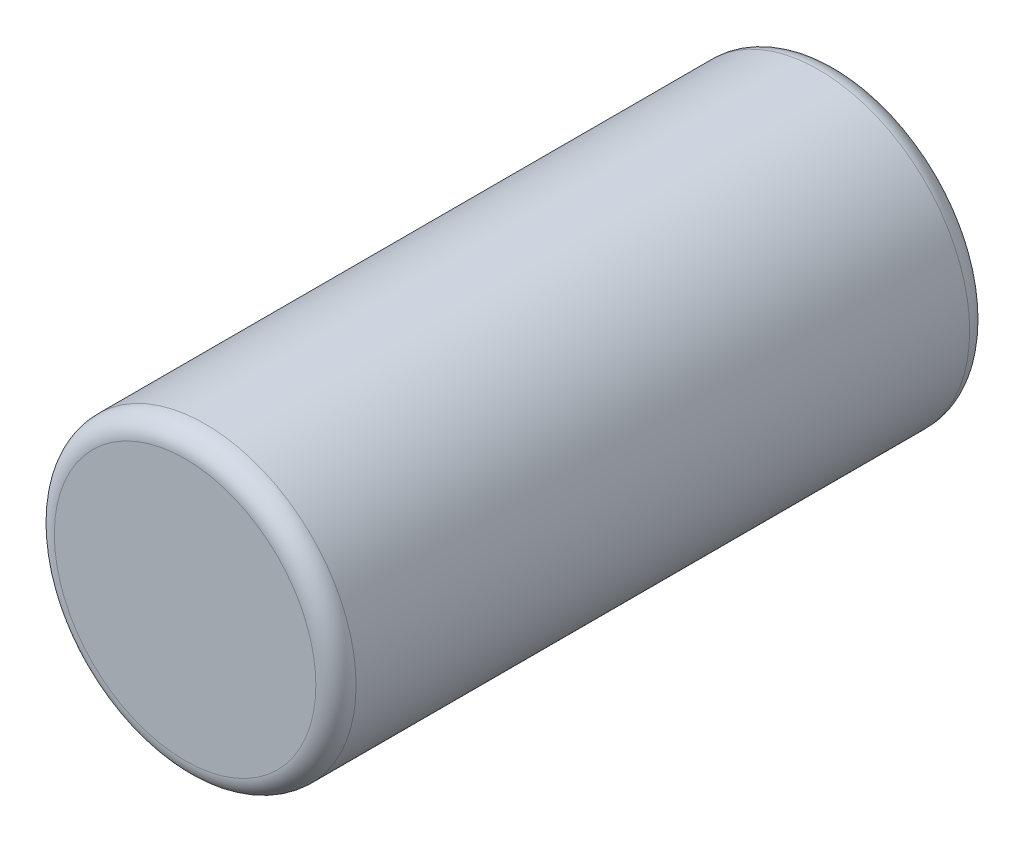
from build123d import *

# Parameters (mm, degrees)
SKETCH_1_R      = 1.5
EXTRUDE_2_DEPTH = 6.5
FILLET_2_R      = 0.2


with BuildPart() as part:
    # Эскиз1 → Бобышка-Вытянуть2 (new body)
    with BuildSketch(Plane.XY):
        Circle(SKETCH_1_R)
    extrude(amount=EXTRUDE_2_DEPTH)

    # Скругление2
    fillet_2_edges = [part.edges().sort_by_distance(p)[0] for p in [
        (-1.5, 0, 0),
        (-1.5, 0, 6.5),
    ]]
    fillet(fillet_2_edges, radius=FILLET_2_R)


solid = part.part
